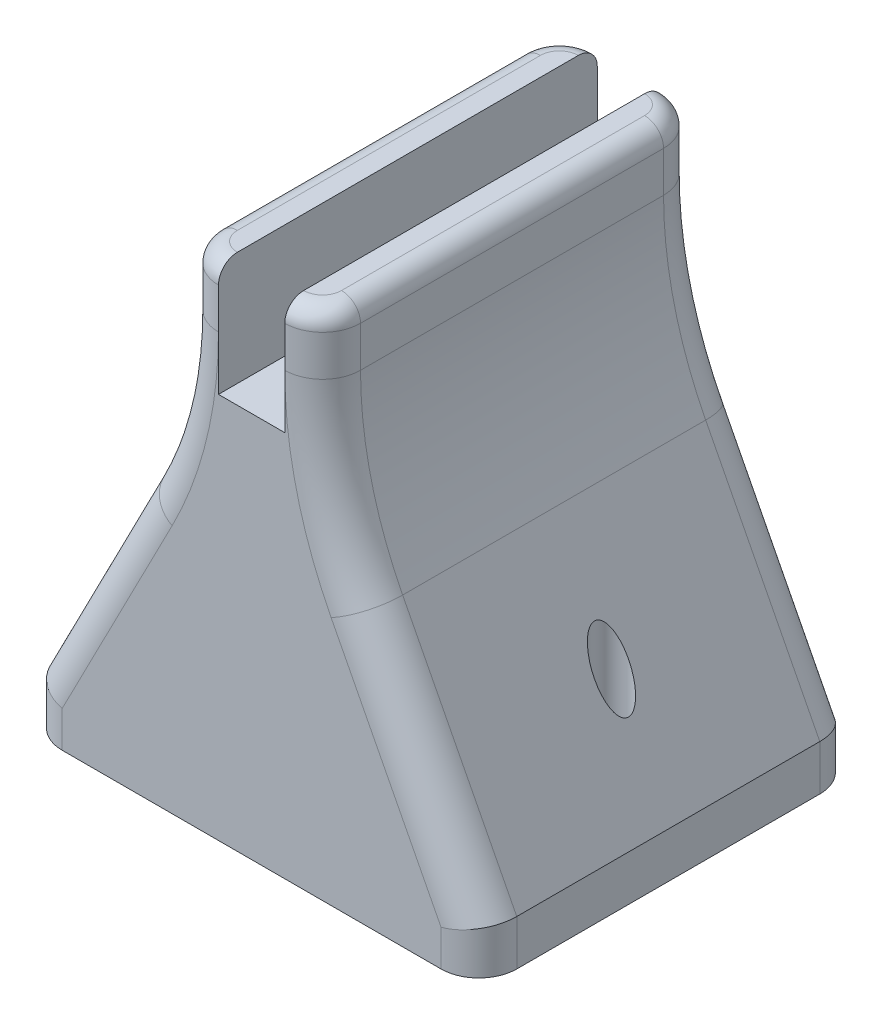
from build123d import *

# Parameters (mm, degrees)
BOSS_EXTRUDE1_DEPTH = 100
SKETCH2_W           = 120
SKETCH2_H           = 100
BOSS_EXTRUDE2_DEPTH = 92
SKETCH3_R           = 4.5
CUT_EXTRUDE1_DEPTH  = 85
SKETCH4_R           = 2.65
CUT_EXTRUDE2_DEPTH  = 7
CUT_EXTRUDE3_REACH  = 159.053
FILLET1_R           = 100
FILLET2_R           = 100
FILLET4_R           = 10
FILLET5_R           = 5


with BuildPart() as part:
    # Sketch1 → Boss-Extrude1 (new body)
    with BuildSketch(Plane.XY):
        Polygon((0, 0), (-37.5, 0), (-37.5, 40), (-27.5, 40), (-27.5, 10), (-10, 10), (-10, 40), (0, 40), align=None)
    extrude(amount=BOSS_EXTRUDE1_DEPTH)

    # Sketch2 → Boss-Extrude2 (add)
    with BuildSketch(Plane.XZ):
        with Locations((-18.75, 50)):
            Rectangle(SKETCH2_W, SKETCH2_H)
    extrude(amount=BOSS_EXTRUDE2_DEPTH)

    # Sketch3 → Cut-Extrude1 (cut)
    with BuildSketch(Plane(origin=(0, 0, 0), x_dir=(1, 0, 0), z_dir=(0, 1, 0))):
        with Locations(Location((26.25, -50, 0), (0, 0, 180))):
            Circle(SKETCH3_R)
        with Locations(Location((-63.75, -50, 0), (0, 0, 180))):
            Circle(SKETCH3_R)
    extrude(amount=-CUT_EXTRUDE1_DEPTH, mode=Mode.SUBTRACT)

    # Sketch4 → Cut-Extrude2 (cut)
    with BuildSketch(Plane(origin=(0, -85, 0), x_dir=(1, 0, 0), z_dir=(0, 1, 0))):
        with Locations(Location((26.25, -50, 0), (0, 0, 180))):
            Circle(SKETCH4_R)
        with Locations(Location((-63.75, -50, 0), (0, 0, 180))):
            Circle(SKETCH4_R)
    extrude(amount=-CUT_EXTRUDE2_DEPTH, mode=Mode.SUBTRACT)

    # Cut-Extrude3: up to this face of the body (flat: up to its plane)
    cut_extrude3_end = Plane(part.part.faces().sort_by_distance((-18.75, -40.86267166, 100))[0])
    # Sketch5 → Cut-Extrude3 (cut, up to the picked face)
    with BuildSketch(Plane(origin=(0, 0, 0), x_dir=(-1, 0, 0), z_dir=(0, 0, -1)), mode=Mode.PRIVATE) as cut_extrude3_sk1:
        Polygon((0, 0), (-41.25, -80), (-41.25, 0), align=None)
    cut_extrude3_tool1 = split(extrude(cut_extrude3_sk1.sketch, amount=-CUT_EXTRUDE3_REACH, mode=Mode.PRIVATE), bisect_by=cut_extrude3_end, keep=Keep.BOTH, mode=Mode.PRIVATE)
    # Sketch5 → Cut-Extrude3 (cut, up to the picked face)
    with BuildSketch(Plane(origin=(0, 0, 0), x_dir=(-1, 0, 0), z_dir=(0, 0, -1)), mode=Mode.PRIVATE) as cut_extrude3_sk2:
        Polygon((37.5, 0), (78.75, 0), (78.75, -80), align=None)
    cut_extrude3_tool2 = split(extrude(cut_extrude3_sk2.sketch, amount=-CUT_EXTRUDE3_REACH, mode=Mode.PRIVATE), bisect_by=cut_extrude3_end, keep=Keep.BOTH, mode=Mode.PRIVATE)
    add(cut_extrude3_tool1.solids().sort_by(Axis((27.5, -26.666667, 0), (0, 0, 1)))[0], mode=Mode.SUBTRACT)
    add(cut_extrude3_tool2.solids().sort_by(Axis((-65, -26.666667, 0), (0, 0, 1)))[0], mode=Mode.SUBTRACT)

    # Fillet1
    fillet1_edges = [part.edges().sort_by_distance(p)[0] for p in [
        (0, 0, 50),
    ]]
    fillet(fillet1_edges, radius=FILLET1_R)

    # Fillet2
    fillet2_edges = [part.edges().sort_by_distance(p)[0] for p in [
        (-37.5, 0, 50),
    ]]
    fillet(fillet2_edges, radius=FILLET2_R)

    # Fillet4
    fillet4_edges = [part.edges().sort_by_distance(p)[0] for p in [
        (-37.5, 32.131733499, 100),
        (-40.319673611, 0.684150576, 100),
        (-37.5, 32.131733499, 0),
        (-40.319673611, 0.684150576, 0),
        (-63.68484163, -50.78272316, 100),
        (-63.68484163, -50.78272316, 0),
        (0, 32.131733499, 0),
        (2.819673611, 0.684150576, 0),
        (0, 32.131733499, 100),
        (2.819673611, 0.684150576, 100),
        (26.18484163, -50.78272316, 0),
        (26.18484163, -50.78272316, 100),
        (41.25, -86, 0),
        (41.25, -86, 100),
        (-78.75, -86, 100),
        (-78.75, -86, 0),
    ]]
    fillet(fillet4_edges, radius=FILLET4_R - 0.0001)  # a hair under: the kernel refuses the full size

    # Fillet5
    fillet5_edges = [part.edges().sort_by_distance(p)[0] for p in [
        (-37.5, 40, 50),
        (-34.571097101, 40, 97.071097101),
        (-34.571097101, 40, 2.928902899),
        (0, 40, 50),
        (-2.928902899, 40, 97.071097101),
        (-2.928902899, 40, 2.928902899),
    ]]
    fillet(fillet5_edges, radius=FILLET5_R)


solid = part.part
